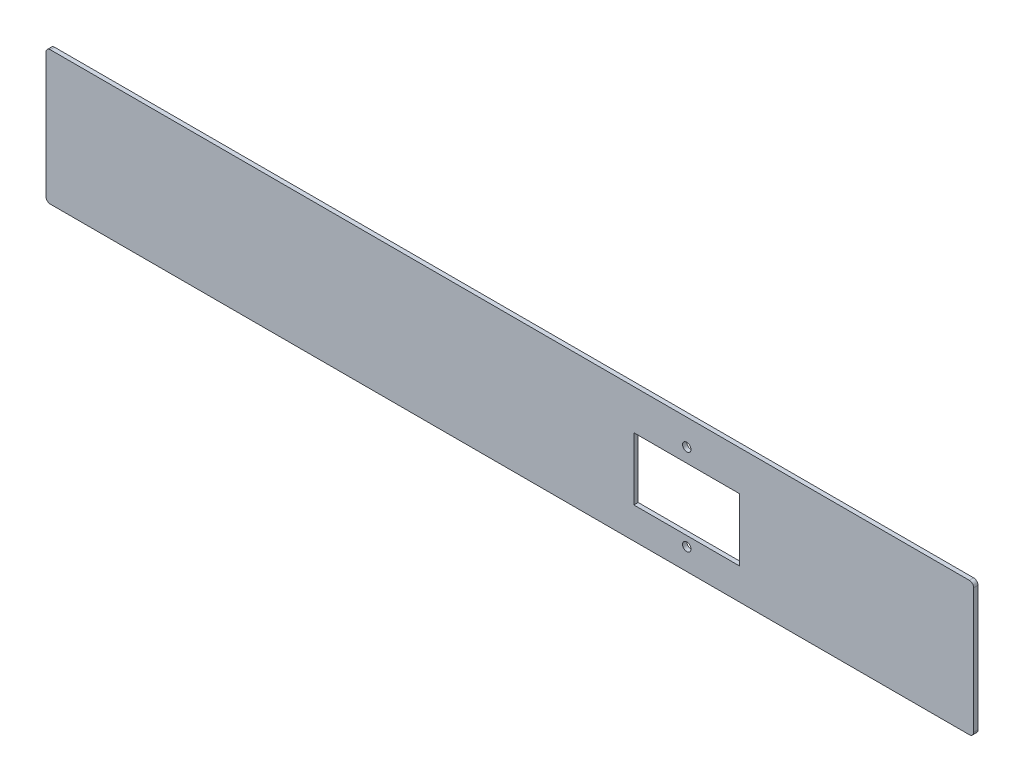
from build123d import *

# Parameters (mm, degrees)
SKETCH1_W           = 430
SKETCH1_H           = 62
SKETCH1_R           = 1.95
SKETCH1_W_2         = 49
SKETCH1_H_2         = 29
BOSS_EXTRUDE1_DEPTH = 2
FILLET1_R           = 2


with BuildPart() as part:
    # Sketch1 → Boss-Extrude1 (new body)
    with BuildSketch(Plane.XY):
        with Locations((-136.924811832, -1.296482412)):
            Rectangle(SKETCH1_W, SKETCH1_H)
        with Locations((-54.924811832, 17.703517588)):
            Circle(SKETCH1_R, mode=Mode.SUBTRACT)
        with Locations((-54.924811832, -22.296482412)):
            Circle(SKETCH1_R, mode=Mode.SUBTRACT)
        with Locations((-54.924811832, -3.296482412)):
            Rectangle(SKETCH1_W_2, SKETCH1_H_2, mode=Mode.SUBTRACT)
    extrude(amount=BOSS_EXTRUDE1_DEPTH)

    # Fillet1
    fillet1_edges = [part.edges().sort_by_distance(p)[0] for p in [
        (78.075188168, 29.703517588, 1),
        (78.075188168, -32.296482412, 1),
        (-351.924811832, -32.296482412, 1),
        (-351.924811832, 29.703517588, 1),
    ]]
    fillet(fillet1_edges, radius=FILLET1_R)


solid = part.part
